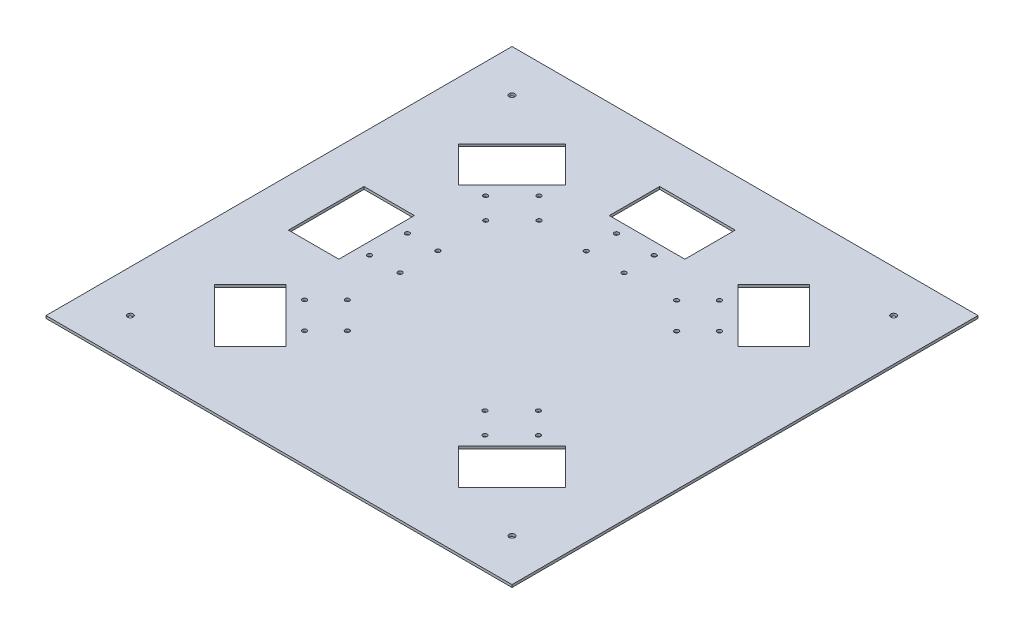
from build123d import *

# Parameters (mm, degrees)
SKETCH1_W           = 370
SKETCH1_H           = 370
SKETCH1_W_2         = 60
SKETCH1_H_2         = 40
SKETCH1_W_3         = 40
SKETCH1_H_3         = 60
SKETCH1_R           = 1.75
SKETCH1_R_2         = 2.25
BOSS_EXTRUDE2_DEPTH = 2


with BuildPart() as part:
    # Sketch1 → Boss-Extrude2 (new body)
    with BuildSketch(Plane(origin=(0, 0, 0), x_dir=(1, 0, 0), z_dir=(0, 1, 0))):
        Rectangle(SKETCH1_W, SKETCH1_H)
        with Locations((-0.133661265, 127.376507427)):
            Rectangle(SKETCH1_W_2, SKETCH1_H_2, mode=Mode.SUBTRACT)
        with Locations((-127.500000449, 0)):
            Rectangle(SKETCH1_W_3, SKETCH1_H_3, mode=Mode.SUBTRACT)
        with Locations((71.5931181, -93.078808311)):
            Circle(SKETCH1_R, mode=Mode.SUBTRACT)
        with Locations((54.622555352, -76.108245563)):
            Circle(SKETCH1_R, mode=Mode.SUBTRACT)
        with Locations((75.835758788, -54.895042127)):
            Circle(SKETCH1_R, mode=Mode.SUBTRACT)
        with Locations((92.806321536, -71.865604876)):
            Circle(SKETCH1_R, mode=Mode.SUBTRACT)
        with Locations((-151.53617158, -151.53617158)):
            Circle(SKETCH1_R_2, mode=Mode.SUBTRACT)
        Polygon((-68.582262997, -110.999199603), (-96.866534244, -139.28347085), (-139.290314967, -96.859690128), (-111.006043719, -68.575418881), align=None, mode=Mode.SUBTRACT)
        with Locations((151.53617158, -151.53617158)):
            Circle(SKETCH1_R_2, mode=Mode.SUBTRACT)
        Polygon((110.999199603, -68.582262997), (139.28347085, -96.866534244), (96.859690128, -139.290314967), (68.575418881, -111.006043719), align=None, mode=Mode.SUBTRACT)
        Polygon((-110.999199603, 68.582262997), (-139.28347085, 96.866534244), (-96.859690128, 139.290314967), (-68.575418881, 111.006043719), align=None, mode=Mode.SUBTRACT)
        with Locations((-151.53617158, 151.53617158)):
            Circle(SKETCH1_R_2, mode=Mode.SUBTRACT)
        Polygon((68.582262997, 110.999199603), (96.866534244, 139.28347085), (139.290314967, 96.859690128), (111.006043719, 68.575418881), align=None, mode=Mode.SUBTRACT)
        with Locations((151.53617158, 151.53617158)):
            Circle(SKETCH1_R_2, mode=Mode.SUBTRACT)
        with Locations((-14.940526024, 97.876024947)):
            Circle(SKETCH1_R, mode=Mode.SUBTRACT)
        with Locations((15.182965202, 73.807380609)):
            Circle(SKETCH1_R, mode=Mode.SUBTRACT)
        with Locations((15.059473976, 97.876024947)):
            Circle(SKETCH1_R, mode=Mode.SUBTRACT)
        with Locations((-14.817034798, 73.807380609)):
            Circle(SKETCH1_R, mode=Mode.SUBTRACT)
        with Locations((76.108245563, 54.622555352)):
            Circle(SKETCH1_R, mode=Mode.SUBTRACT)
        with Locations((54.895042127, 75.835758788)):
            Circle(SKETCH1_R, mode=Mode.SUBTRACT)
        with Locations((93.078808311, 71.5931181)):
            Circle(SKETCH1_R, mode=Mode.SUBTRACT)
        with Locations((71.865604876, 92.806321536)):
            Circle(SKETCH1_R, mode=Mode.SUBTRACT)
        with Locations((-93.078808311, -71.5931181)):
            Circle(SKETCH1_R, mode=Mode.SUBTRACT)
        with Locations((-54.895042127, -75.835758788)):
            Circle(SKETCH1_R, mode=Mode.SUBTRACT)
        with Locations((-76.108245563, -54.622555352)):
            Circle(SKETCH1_R, mode=Mode.SUBTRACT)
        with Locations((-71.865604876, -92.806321536)):
            Circle(SKETCH1_R, mode=Mode.SUBTRACT)
        with Locations((-73.930871834, -14.940526024)):
            Circle(SKETCH1_R, mode=Mode.SUBTRACT)
        with Locations((-97.999516173, 14.935982751)):
            Circle(SKETCH1_R, mode=Mode.SUBTRACT)
        with Locations((-73.930871834, 15.059473976)):
            Circle(SKETCH1_R, mode=Mode.SUBTRACT)
        with Locations((-97.999516173, -15.064017249)):
            Circle(SKETCH1_R, mode=Mode.SUBTRACT)
        with Locations((-54.622555352, 76.108245563)):
            Circle(SKETCH1_R, mode=Mode.SUBTRACT)
        with Locations((-71.5931181, 93.078808311)):
            Circle(SKETCH1_R, mode=Mode.SUBTRACT)
        with Locations((-92.806321536, 71.865604876)):
            Circle(SKETCH1_R, mode=Mode.SUBTRACT)
        with Locations((-75.835758788, 54.895042127)):
            Circle(SKETCH1_R, mode=Mode.SUBTRACT)
    extrude(amount=BOSS_EXTRUDE2_DEPTH)


solid = part.part
